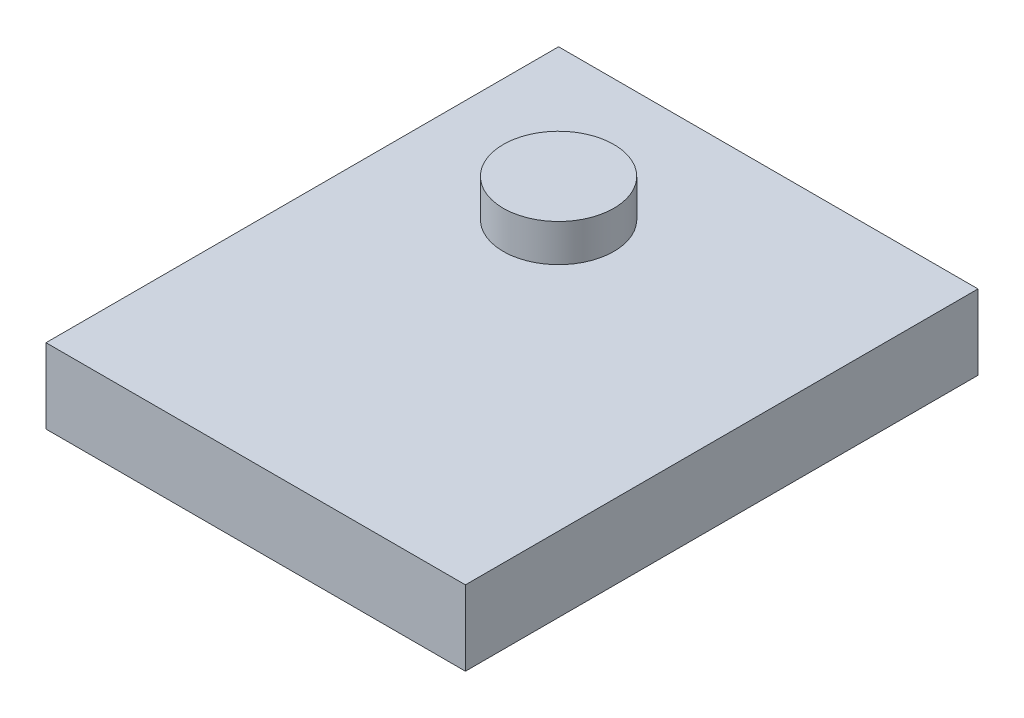
from build123d import *

# Parameters (mm, degrees)
SKETCH1_W           = 56.0520382
SKETCH1_H           = 68.5
BOSS_EXTRUDE1_DEPTH = 10
SKETCH1_3_R         = 7.39
BOSS_EXTRUDE2_DEPTH = 5


with BuildPart() as part:
    # Sketch1 → Boss-Extrude1 (new body)
    with BuildSketch(Plane(origin=(0, 0, 0), x_dir=(1, 0, 0), z_dir=(0, 1, 0))):
        with Locations((8.0260191, -14.25)):
            Rectangle(SKETCH1_W, SKETCH1_H)
    extrude(amount=-BOSS_EXTRUDE1_DEPTH)

    # Sketch1<3> → Boss-Extrude2 (add)
    with BuildSketch(Plane(origin=(0, 0, 0), x_dir=(1, 0, 0), z_dir=(0, 1, 0))):
        Circle(SKETCH1_3_R)
    extrude(amount=BOSS_EXTRUDE2_DEPTH)


solid = part.part
